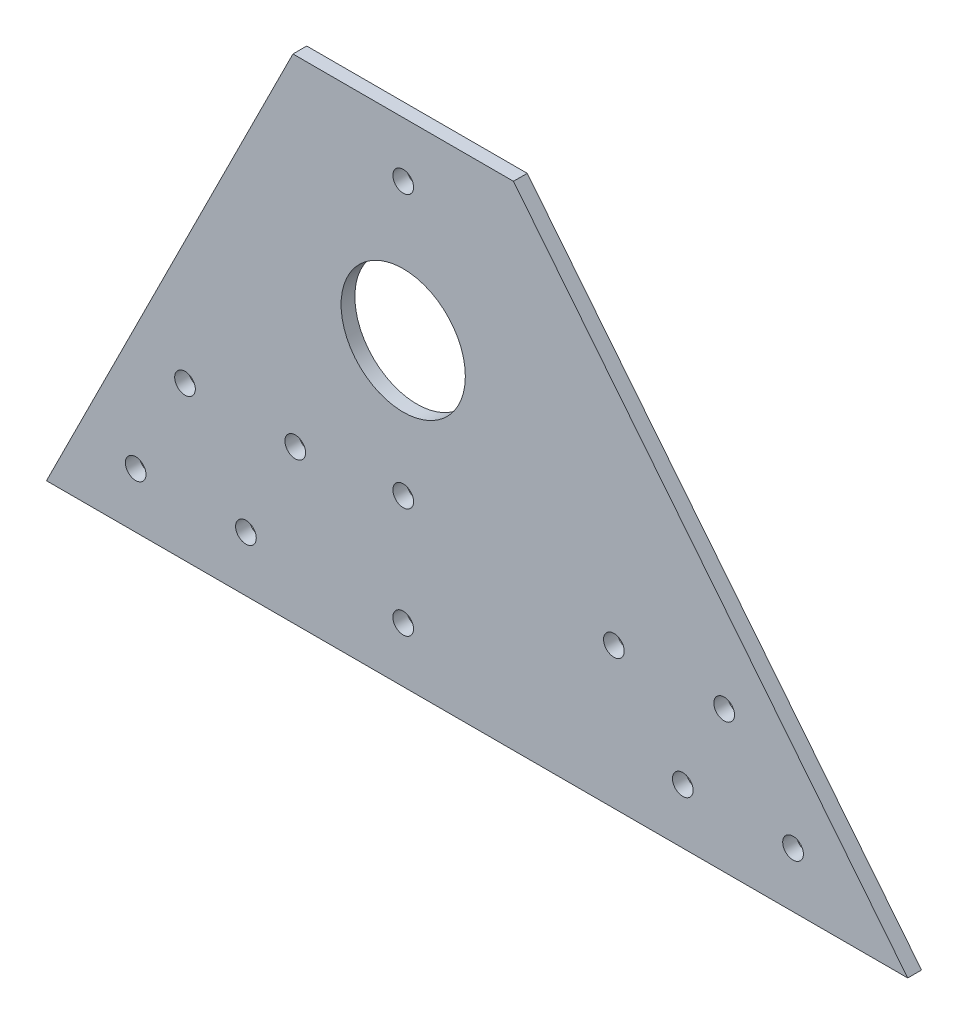
from build123d import *

# Parameters (mm, degrees)
SKETCH1_R           = 14.3129
BOSS_EXTRUDE1_DEPTH = 3.175
SKETCH2_R           = 2.38125
CUT_EXTRUDE1_DEPTH  = 130.392622385
SKETCH3_R           = 2.38125
CUT_EXTRUDE2_DEPTH  = 130.392622385


with BuildPart() as part:
    # Sketch1 → Boss-Extrude1 (new body)
    with BuildSketch(Plane.XY):
        Polygon((116.231023146, -56.769), (25.4, 56.769), (-25.4, 56.769), (-82.181258838, -56.769), align=None)
        with Locations((0, 12.319)):
            Circle(SKETCH1_R, mode=Mode.SUBTRACT)
    extrude(amount=BOSS_EXTRUDE1_DEPTH)

    # Sketch2 → Cut-Extrude1 (cut, through all)
    with BuildSketch(Plane.XY.offset(3.175)):
        with Locations((-61.630242658, -44.069)):
            Circle(SKETCH2_R)
        with Locations((-36.230242658, -44.069)):
            Circle(SKETCH2_R)
        with Locations((-50.269055108, -21.351530567)):
            Circle(SKETCH2_R)
        with Locations((-24.869055108, -21.351530567)):
            Circle(SKETCH2_R)
        with Locations((64.406974336, -44.069)):
            Circle(SKETCH2_R)
        with Locations((89.806974336, -44.069)):
            Circle(SKETCH2_R)
        with Locations((48.539653752, -24.234985342)):
            Circle(SKETCH2_R)
        with Locations((73.939653752, -24.234985342)):
            Circle(SKETCH2_R)
    extrude(amount=-CUT_EXTRUDE1_DEPTH, mode=Mode.SUBTRACT)

    # Sketch3 → Cut-Extrude2 (cut, through all)
    with BuildSketch(Plane.XY.offset(3.175)):
        with Locations((0, 44.069)):
            Circle(SKETCH3_R)
        with Locations((0, -18.669)):
            Circle(SKETCH3_R)
        with Locations((0, -44.069)):
            Circle(SKETCH3_R)
    extrude(amount=-CUT_EXTRUDE2_DEPTH, mode=Mode.SUBTRACT)


solid = part.part
